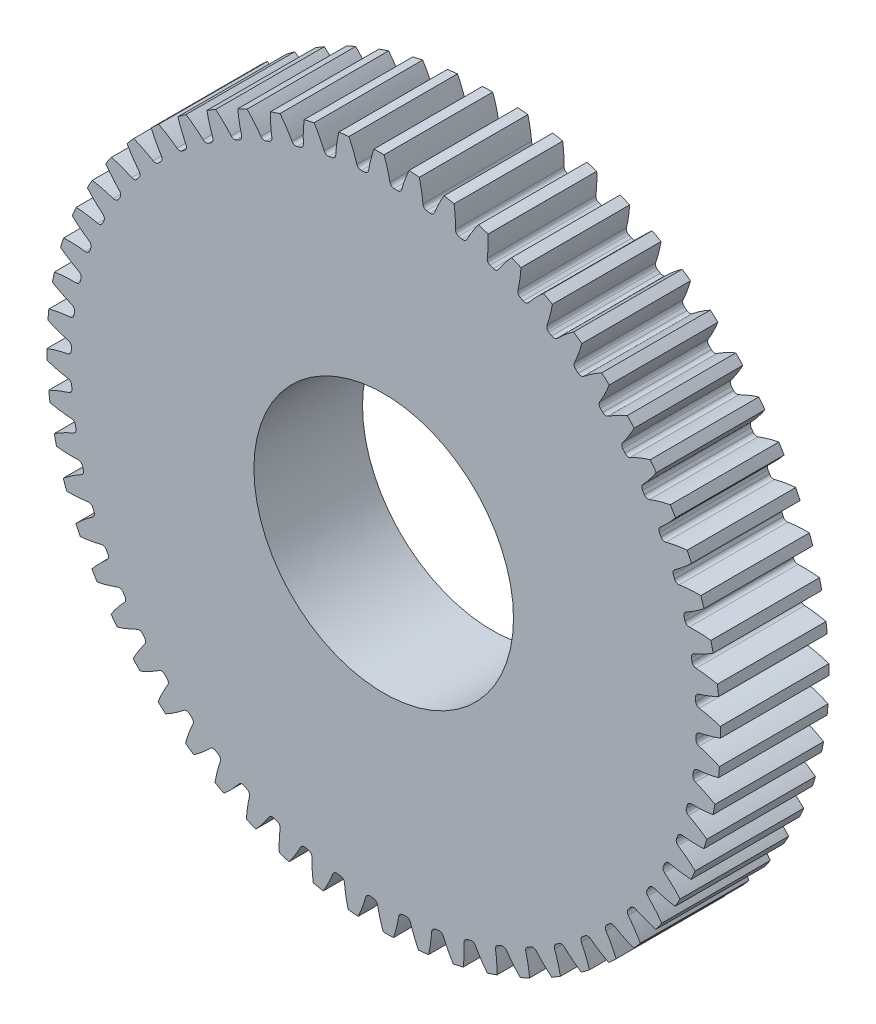
from build123d import *

# Parameters (mm, degrees)
SKETCH3_R         = 78.74
GEARBODY_DEPTH    = 25.4
TOOTHCUT_DEPTH    = 115.215301952
CIRPATTERN1_COUNT = 60
BOREDIA_R         = 30.353001332
BORE_DEPTH        = 12700


with BuildPart() as part:
    # Sketch3 → gearBody (new body)
    with BuildSketch(Plane.XY):
        Circle(SKETCH3_R)
    extrude(amount=GEARBODY_DEPTH)

    # Sketch2 → toothCut (cut, through all)
    with BuildSketch(Plane.XY):
        with BuildLine():
            ThreePointArc((73.03100387, -3.20279802), (73.047280236, -2.807185711), (73.061413567, -2.411491046))
            ThreePointArc((73.061413567, -2.411491046), (73.30149223, -1.7922886), (73.875449596, -1.458189248))
            ThreePointArc((73.875449596, -1.458189248), (84.75836029, 2.96137177), (93.135799821, 11.194765462))
            ThreePointArc((93.135799821, 11.194765462), (93.73699122, -3.60228528), (92.001957355, -18.309555566))
            ThreePointArc((92.001957355, -18.309555566), (84.281106308, -9.457509255), (73.769476867, -4.215762288))
            ThreePointArc((73.769476867, -4.215762288), (73.222853105, -3.83859933), (73.03100387, -3.20279802))
        make_face()
    toothcut = extrude(amount=TOOTHCUT_DEPTH, mode=Mode.SUBTRACT)

    # CirPattern1: toothCut ×60 about axis
    cirpattern1_axis = Axis((0, 0, 25.4), (0, 0, -1))
    for i in range(1, CIRPATTERN1_COUNT):
        add(toothcut.rotate(cirpattern1_axis, i * 360 / CIRPATTERN1_COUNT), mode=Mode.SUBTRACT)

    # boreDia → bore (cut, symmetric)
    with BuildSketch(Plane.XY):
        Circle(BOREDIA_R)
    extrude(amount=BORE_DEPTH, both=True, mode=Mode.SUBTRACT)


solid = part.part
